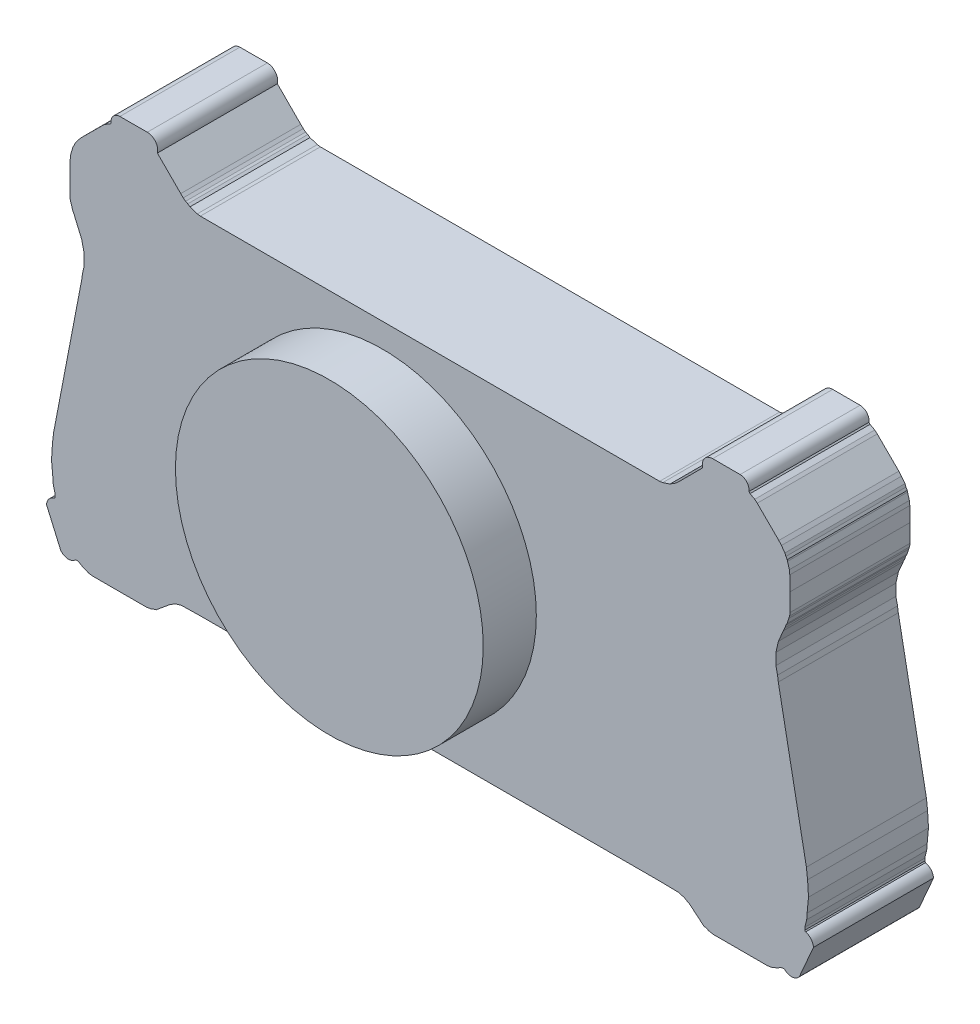
from build123d import *

# Parameters (mm, degrees)
ESBO_O2_W                = 173
ESBO_O2_H                = 45.2
RESSALTO_EXTRUS_O2_DEPTH = 65.2
ESBO_O3_R                = 57.970457698
RESSALTO_EXTRUS_O3_DEPTH = 20
RESSALTO_EXTRUS_O4_START = -45.2
RESSALTO_EXTRUS_O4_DEPTH = 45.2


# Read off the part's stored shape, not the designer's step: Ressalto-extrusão4
with BuildPart() as part:
    # Esboço2 → Ressalto-extrusão2 (new, symmetric)
    with BuildSketch(Plane(origin=(0, 0, 0), x_dir=(1, 0, 0), z_dir=(0, 1, 0))):
        Rectangle(ESBO_O2_W, ESBO_O2_H)
    extrude(amount=RESSALTO_EXTRUS_O2_DEPTH, both=True)

    # Esboço3 → Ressalto-extrusão3 (add)
    with BuildSketch(Plane.XY.offset(22.6)):
        with Locations((-17.919078136, -1.804884681)):
            Circle(ESBO_O3_R)
    extrude(amount=RESSALTO_EXTRUS_O3_DEPTH)

    # Ressalto-extrusão4 outline → Ressalto-extrusão4 (add)
    with BuildSketch(Plane.XY.offset(22.6).offset(RESSALTO_EXTRUS_O4_START)):
        with BuildLine():
            Line((102.68744208, 77.672367144), (93.883087158, 68.853831482))
            Line((93.883087158, 68.853831482), (92.930908203, 67.948153687))
            Line((92.930908203, 67.948153687), (92.052246094, 67.253565979))
            Line((92.052246094, 67.253565979), (91.246276855, 66.845568848))
            Line((91.246276855, 66.845568848), (90.411560059, 66.271777344))
            Line((90.411560059, 66.271777344), (87.657562256, 65.351000977))
            Line((87.657562256, 65.351000977), (86.5, 65.2))
            Line((86.5, 65.2), (86.5, -65.2))
            Line((86.5, -65.2), (93.839447021, -65.336684036))
            Line((93.839447021, -65.336684036), (95.128540039, -65.774876404))
            Line((95.128540039, -65.774876404), (95.626312256, -65.865172195))
            Line((95.626312256, -65.865172195), (97.838317871, -67.1335495))
            Line((97.838317871, -67.1335495), (103.111968994, -71.512766647))
            Line((103.111968994, -71.512766647), (104.284179687, -71.844658661))
            Line((104.284179687, -71.844658661), (105.016326904, -72.192253876))
            Line((105.016326904, -72.192253876), (106.758210561, -72.501532079))
            Line((106.758210561, -72.501532079), (127.042376704, -72.501532079))
            Line((127.042376704, -72.501532079), (128.748016357, -72.237250137))
            Line((128.748016357, -72.237250137), (129.333953857, -71.920157242))
            Line((129.333953857, -71.920157242), (130.505584717, -71.542965698))
            Line((130.505584717, -71.542965698), (132.116973877, -70.621580887))
            Line((132.116973877, -70.621580887), (132.908325195, -70.379986572))
            Line((132.908325195, -70.379986572), (133.581878662, -70.455786514))
            ThreePointArc((133.581878662, -70.455786514), (136.426489502, -71.540170383), (139.104858398, -70.09309082))
            Line((139.104858398, -70.09309082), (144.451446533, -57.847529221))
            ThreePointArc((144.451446533, -57.847529221), (143.532086949, -55.594745414), (141.463348389, -54.313895035))
            Line((141.463348389, -54.313895035), (141.155700684, -53.921302605))
            Line((141.155700684, -53.921302605), (141.155700684, -52.985422897))
            Line((141.155700684, -52.985422897), (141.8878479, -50.116176057))
            Line((141.8878479, -50.116176057), (142.04901123, -47.851521599))
            Line((142.04901123, -47.851521599), (142.561706543, -42.41532402))
            Line((142.561706543, -42.41532402), (142.217758179, -36.926730919))
            Line((142.217758179, -36.926730919), (141.770965576, -33.015906143))
            Line((141.770965576, -33.015906143), (131.194091797, 22.060099792))
            Line((131.194091797, 22.060099792), (130.901397705, 24.174060059))
            Line((130.901397705, 24.174060059), (130.286132812, 26.96738739))
            Line((130.286132812, 26.96738739), (130.286132812, 31.270747375))
            Line((130.286132812, 31.270747375), (131.20904541, 35.347880554))
            Line((131.20904541, 35.347880554), (133.098449707, 39.741893005))
            Line((133.098449707, 39.741893005), (133.699371338, 41.055262756))
            Line((133.699371338, 41.055262756), (133.97769165, 41.886050415))
            Line((133.97769165, 41.886050415), (134.49041748, 42.821932983))
            Line((134.49041748, 42.821932983), (135.134979248, 44.815394592))
            Line((135.134979248, 44.815394592), (135.427642822, 45.69118042))
            Line((135.427642822, 45.69118042), (135.632751465, 46.974353027))
            Line((135.632751465, 46.974353027), (135.60345459, 53.694026184))
            Line((135.60345459, 53.694026184), (135.515838623, 59.205119324))
            Line((135.515838623, 59.205119324), (135.354400635, 60.790583801))
            Line((135.354400635, 60.790583801), (134.665893555, 63.161540222))
            Line((134.665893555, 63.161540222), (134.54901123, 63.659831238))
            Line((134.54901123, 63.659831238), (134.065307617, 64.490313721))
            Line((134.065307617, 64.490313721), (133.684417725, 65.441600037))
            Line((133.684417725, 65.441600037), (132.36630249, 67.208262634))
            Line((132.36630249, 67.208262634), (131.38482666, 68.355540466))
            Line((131.38482666, 68.355540466), (123.254638672, 76.434184265))
            Line((123.254638672, 76.434184265), (122.302154541, 77.249568176))
            Line((122.302154541, 77.249568176), (120.544555664, 78.200854492))
            Line((120.544555664, 78.200854492), (120.134399414, 78.668643188))
            ThreePointArc((120.134399414, 78.668643188), (119.353688391, 81.369611441), (116.808776855, 82.5646698))
            Line((116.808776855, 82.5646698), (106.483274703, 82.583373499))
            ThreePointArc((106.483274703, 82.583373499), (103.379795658, 81.059678188), (102.68744208, 77.672367144))
        make_face()
        with BuildLine():
            Line((-128.748016357, -72.237250137), (-127.042376704, -72.501532079))
            Line((-127.042376704, -72.501532079), (-106.758210561, -72.501532079))
            Line((-106.758210561, -72.501532079), (-105.016326904, -72.192253876))
            Line((-105.016326904, -72.192253876), (-104.284179688, -71.844658661))
            Line((-104.284179688, -71.844658661), (-103.111968994, -71.512766647))
            Line((-103.111968994, -71.512766647), (-97.838317871, -67.1335495))
            Line((-97.838317871, -67.1335495), (-95.626312256, -65.865172195))
            Line((-95.626312256, -65.865172195), (-95.128540039, -65.774876404))
            Line((-95.128540039, -65.774876404), (-93.839447021, -65.336684036))
            Line((-93.839447021, -65.336684036), (-86.5, -65.2))
            Line((-86.5, -65.2), (-86.5, 65.2))
            Line((-86.5, 65.2), (-87.657562256, 65.351000977))
            Line((-87.657562256, 65.351000977), (-90.411560059, 66.271777344))
            Line((-90.411560059, 66.271777344), (-91.246276855, 66.845568848))
            Line((-91.246276855, 66.845568848), (-92.052246094, 67.253565979))
            Line((-92.052246094, 67.253565979), (-92.930908203, 67.948153687))
            Line((-92.930908203, 67.948153687), (-93.883087158, 68.853831482))
            Line((-93.883087158, 68.853831482), (-102.68744208, 77.672367144))
            ThreePointArc((-102.68744208, 77.672367144), (-103.379795658, 81.059678188), (-106.483274703, 82.583373499))
            Line((-106.483274703, 82.583373499), (-116.808776855, 82.5646698))
            ThreePointArc((-116.808776855, 82.5646698), (-119.353688391, 81.369611441), (-120.134399414, 78.668643188))
            Line((-120.134399414, 78.668643188), (-120.544555664, 78.200854492))
            Line((-120.544555664, 78.200854492), (-122.302154541, 77.249568176))
            Line((-122.302154541, 77.249568176), (-123.254638672, 76.434184265))
            Line((-123.254638672, 76.434184265), (-131.38482666, 68.355540466))
            Line((-131.38482666, 68.355540466), (-132.36630249, 67.208262634))
            Line((-132.36630249, 67.208262634), (-133.684417725, 65.441600037))
            Line((-133.684417725, 65.441600037), (-134.065307617, 64.490313721))
            Line((-134.065307617, 64.490313721), (-134.54901123, 63.659831238))
            Line((-134.54901123, 63.659831238), (-134.665893555, 63.161540222))
            Line((-134.665893555, 63.161540222), (-135.354400635, 60.790583801))
            Line((-135.354400635, 60.790583801), (-135.515838623, 59.205119324))
            Line((-135.515838623, 59.205119324), (-135.60345459, 53.694026184))
            Line((-135.60345459, 53.694026184), (-135.632751465, 46.974353027))
            Line((-135.632751465, 46.974353027), (-135.427642822, 45.69118042))
            Line((-135.427642822, 45.69118042), (-135.134979248, 44.815394592))
            Line((-135.134979248, 44.815394592), (-134.49041748, 42.821932983))
            Line((-134.49041748, 42.821932983), (-133.97769165, 41.886050415))
            Line((-133.97769165, 41.886050415), (-133.699371338, 41.055262756))
            Line((-133.699371338, 41.055262756), (-133.098449707, 39.741893005))
            Line((-133.098449707, 39.741893005), (-131.20904541, 35.347880554))
            Line((-131.20904541, 35.347880554), (-130.286132813, 31.270747375))
            Line((-130.286132813, 31.270747375), (-130.286132812, 26.96738739))
            Line((-130.286132812, 26.96738739), (-130.901397705, 24.174060059))
            Line((-130.901397705, 24.174060059), (-131.194091797, 22.060099792))
            Line((-131.194091797, 22.060099792), (-141.770965576, -33.015906143))
            Line((-141.770965576, -33.015906143), (-142.217758179, -36.926730919))
            Line((-142.217758179, -36.926730919), (-142.561706543, -42.41532402))
            Line((-142.561706543, -42.41532402), (-142.04901123, -47.851521599))
            Line((-142.04901123, -47.851521599), (-141.8878479, -50.116176057))
            Line((-141.8878479, -50.116176057), (-141.155700684, -52.985422897))
            Line((-141.155700684, -52.985422897), (-141.155700684, -53.921302605))
            Line((-141.155700684, -53.921302605), (-141.463348389, -54.313895035))
            ThreePointArc((-141.463348389, -54.313895035), (-143.532086949, -55.594745414), (-144.451446533, -57.847529221))
            Line((-144.451446533, -57.847529221), (-139.104858398, -70.09309082))
            ThreePointArc((-139.104858398, -70.09309082), (-136.426489502, -71.540170383), (-133.581878662, -70.455786514))
            Line((-133.581878662, -70.455786514), (-132.908325195, -70.379986572))
            Line((-132.908325195, -70.379986572), (-132.116973877, -70.621580887))
            Line((-132.116973877, -70.621580887), (-130.505584717, -71.542965698))
            Line((-130.505584717, -71.542965698), (-129.333953857, -71.920157242))
            Line((-129.333953857, -71.920157242), (-128.748016357, -72.237250137))
        make_face()
    extrude(amount=RESSALTO_EXTRUS_O4_DEPTH)


solid = part.part
